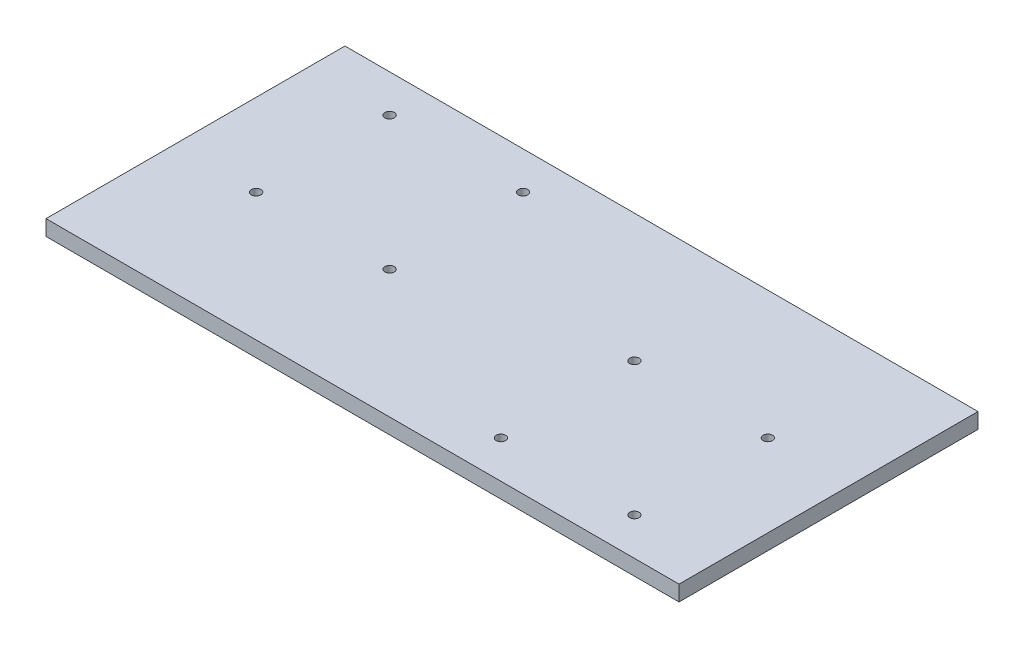
from build123d import *

# Parameters (mm, degrees)
SKETCH1_W            = 228.6
SKETCH1_H            = 107.95
BOSS_EXTRUDE1_DEPTH  = 5.588
M3_CLEARANCE_HOLE1_D = 3.4


with BuildPart() as part:
    # Sketch1 → Boss-Extrude1 (new body)
    with BuildSketch(Plane(origin=(0, 0, 0), x_dir=(1, 0, 0), z_dir=(0, 1, 0))):
        Rectangle(SKETCH1_W, SKETCH1_H)
    extrude(amount=BOSS_EXTRUDE1_DEPTH)

    # M3 Clearance Hole1 (through all)
    with Locations(Plane(origin=(0, 5.588, 0), x_dir=(1, 0, 0), z_dir=(0, 1, 0))):
        with Locations((-84.612, -7.775), (-84.612, 40.415), (-36.422, 40.415), (-36.422, -7.775), (84.612, 7.775), (84.612, -40.415), (36.422, -40.415), (36.422, 7.775)):
            Hole(M3_CLEARANCE_HOLE1_D / 2)


solid = part.part
